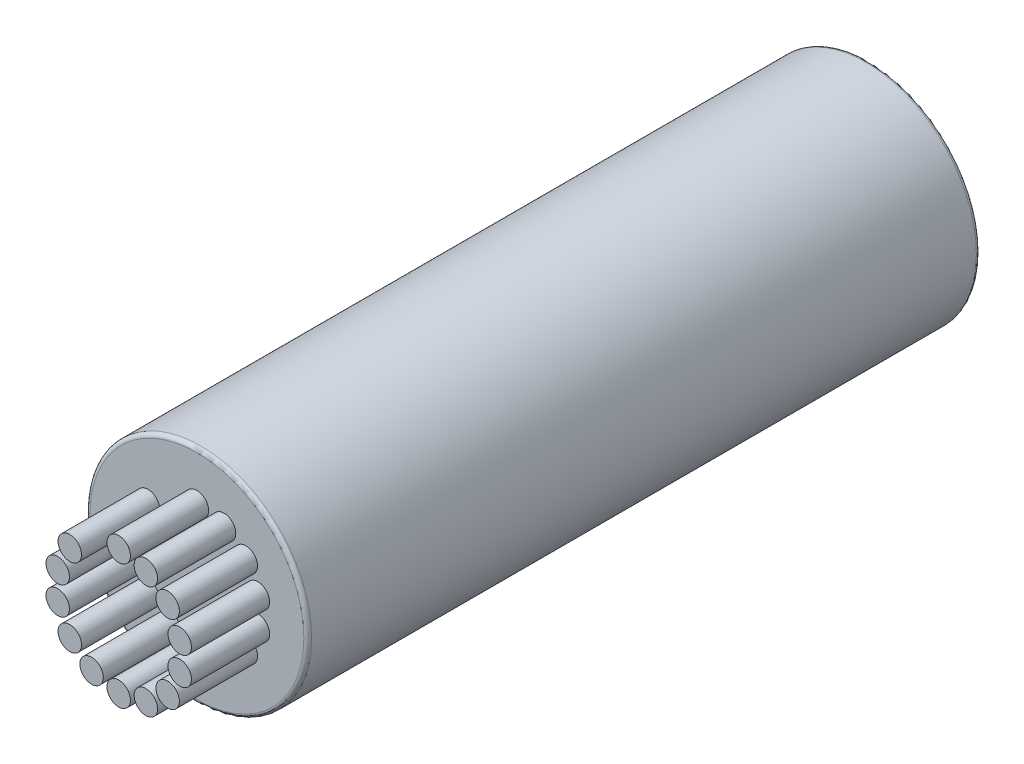
from build123d import *

# Parameters (mm, degrees)
SKETCH1_R           = 7.0865
BOSS_EXTRUDE1_DEPTH = 43
SKETCH2_R           = 5
CUT_EXTRUDE1_DEPTH  = 0.1
SKETCH3_R           = 0.75
BOSS_EXTRUDE2_DEPTH = 5
FILLET1_R           = 0.25


with BuildPart() as part:
    # Sketch1 → Boss-Extrude1 (new body)
    with BuildSketch(Plane.XY):
        Circle(SKETCH1_R)
    extrude(amount=BOSS_EXTRUDE1_DEPTH)

    # Sketch2 → Cut-Extrude1 (cut)
    with BuildSketch(Plane(origin=(0, 0, 0), x_dir=(-1, 0, 0), z_dir=(0, 0, -1))):
        Circle(SKETCH2_R)
    extrude(amount=-CUT_EXTRUDE1_DEPTH, mode=Mode.SUBTRACT)

    # Sketch3 → Boss-Extrude2 (add)
    with BuildSketch(Plane.XY.offset(43)):
        with Locations((0, 4)):
            Circle(SKETCH3_R)
        with Locations((1.735534956, 3.603875472)):
            Circle(SKETCH3_R)
        with Locations((3.12732593, 2.493959207)):
            Circle(SKETCH3_R)
        with Locations((3.899711649, 0.890083736)):
            Circle(SKETCH3_R)
        with Locations((3.899711649, -0.890083736)):
            Circle(SKETCH3_R)
        with Locations((3.12732593, -2.493959207)):
            Circle(SKETCH3_R)
        with Locations((1.735534956, -3.603875472)):
            Circle(SKETCH3_R)
        with Locations((0, -4)):
            Circle(SKETCH3_R)
        with Locations((-1.735534956, -3.603875472)):
            Circle(SKETCH3_R)
        with Locations((-3.12732593, -2.493959207)):
            Circle(SKETCH3_R)
        with Locations((-3.899711649, -0.890083736)):
            Circle(SKETCH3_R)
        with Locations((-3.899711649, 0.890083736)):
            Circle(SKETCH3_R)
        with Locations((-3.12732593, 2.493959207)):
            Circle(SKETCH3_R)
    extrude(amount=BOSS_EXTRUDE2_DEPTH)

    # Fillet1
    fillet1_edges = [part.edges().sort_by_distance(p)[0] for p in [
        (-7.0865, 0, 43),
        (-7.0865, 0, 0),
    ]]
    fillet(fillet1_edges, radius=FILLET1_R)


solid = part.part
